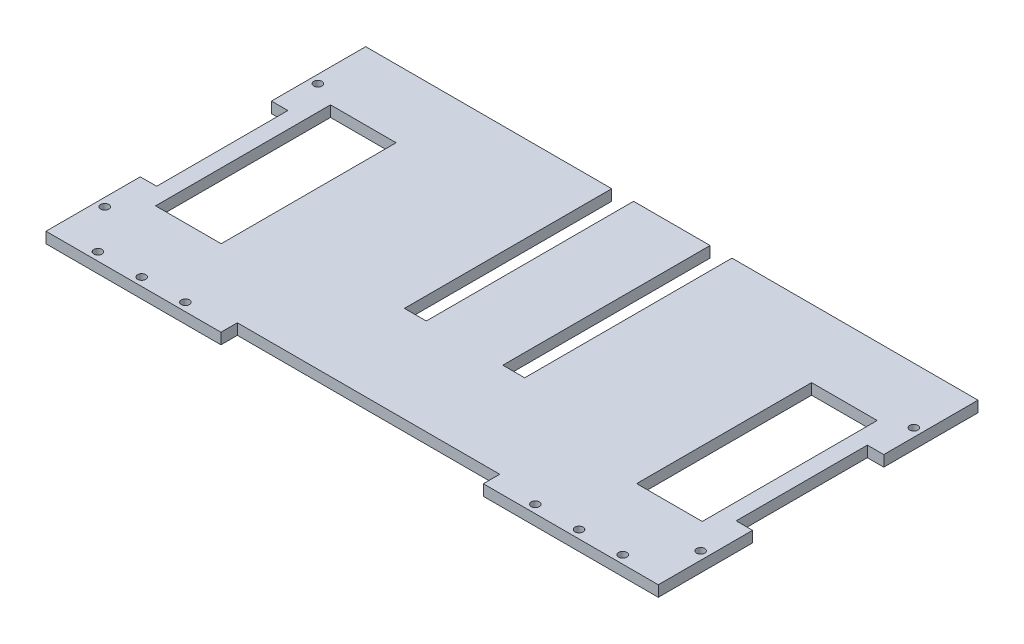
from build123d import *

# Parameters (mm, degrees)
BOSS_EXTRUDE1_DEPTH     = 6.35
CUT_EXTRUDE8_DEPTH      = 226.268216746
CUT_EXTRUDE8_DEPTH_BACK = 226.268216746
SKETCH35_R              = 2.38125
SKETCH36_W              = 12.7
SKETCH36_H              = 152.4
CUT_EXTRUDE9_DEPTH      = 226.268216746
SKETCH37_W              = 38.1
SKETCH37_H              = 101.6
CUT_EXTRUDE10_DEPTH     = 226.268216746


with BuildPart() as part:
    # Sketch1 → Boss-Extrude1 (new body)
    with BuildSketch(Plane(origin=(0, 0, 0), x_dir=(1, 0, 0), z_dir=(0, 1, 0))):
        Polygon((-177.8, -138.176), (-76.2, -138.176), (-76.2, -128.651), (76.2, -128.651), (76.2, -138.176), (177.8, -138.176), (177.8, -83.439), (168.275, -83.439), (168.275, -7.239), (177.8, -7.239), (177.8, 47.498), (-177.8, 47.498), (-177.8, -7.239), (-168.275, -7.239), (-168.275, -83.439), (-177.8, -83.439), align=None)
    extrude(amount=BOSS_EXTRUDE1_DEPTH)

    # Sketch35 → Cut-Extrude8 (cut, two sides: drawn at the far end of the back side and taken through both)
    with BuildSketch(Plane(origin=(0, 0, 0), x_dir=(-1, 0, 0), z_dir=(0, -1, 0)).offset(-CUT_EXTRUDE8_DEPTH_BACK)):
        with Locations(Location((-173.0375, 14.986, 0), (0, 0, 90))):
            Circle(SKETCH35_R)
        with Locations(Location((-173.0375, -108.839, 0), (0, 0, 90))):
            Circle(SKETCH35_R)
        with Locations(Location((-101.6, -133.4135, 0), (0, 0, 90))):
            Circle(SKETCH35_R)
        with Locations(Location((-127, -133.4135, 0), (0, 0, 90))):
            Circle(SKETCH35_R)
        with Locations(Location((-152.4, -133.4135, 0), (0, 0, 90))):
            Circle(SKETCH35_R)
        with Locations(Location((101.6, -133.4135, 0), (0, 0, 270))):
            Circle(SKETCH35_R)
        with Locations(Location((127, -133.4135, 0), (0, 0, 270))):
            Circle(SKETCH35_R)
        with Locations(Location((152.4, -133.4135, 0), (0, 0, 270))):
            Circle(SKETCH35_R)
        with Locations(Location((173.0375, -108.839, 0), (0, 0, 270))):
            Circle(SKETCH35_R)
        with Locations(Location((173.0375, 14.986, 0), (0, 0, 270))):
            Circle(SKETCH35_R)
    extrude(amount=CUT_EXTRUDE8_DEPTH + CUT_EXTRUDE8_DEPTH_BACK, mode=Mode.SUBTRACT)

    # Sketch36 → Cut-Extrude9 (cut, through all)
    with BuildSketch(Plane.XZ):
        with Locations((-28.575, -3.302)):
            Rectangle(SKETCH36_W, SKETCH36_H)
        with Locations((28.575, -3.302)):
            Rectangle(SKETCH36_W, SKETCH36_H)
    extrude(amount=-CUT_EXTRUDE9_DEPTH, mode=Mode.SUBTRACT)

    # Sketch37 → Cut-Extrude10 (cut, through all)
    with BuildSketch(Plane.XZ):
        with Locations((-139.7, 42.799)):
            Rectangle(SKETCH37_W, SKETCH37_H)
        with Locations((139.7, 42.799)):
            Rectangle(SKETCH37_W, SKETCH37_H)
    extrude(amount=-CUT_EXTRUDE10_DEPTH, mode=Mode.SUBTRACT)


solid = part.part
